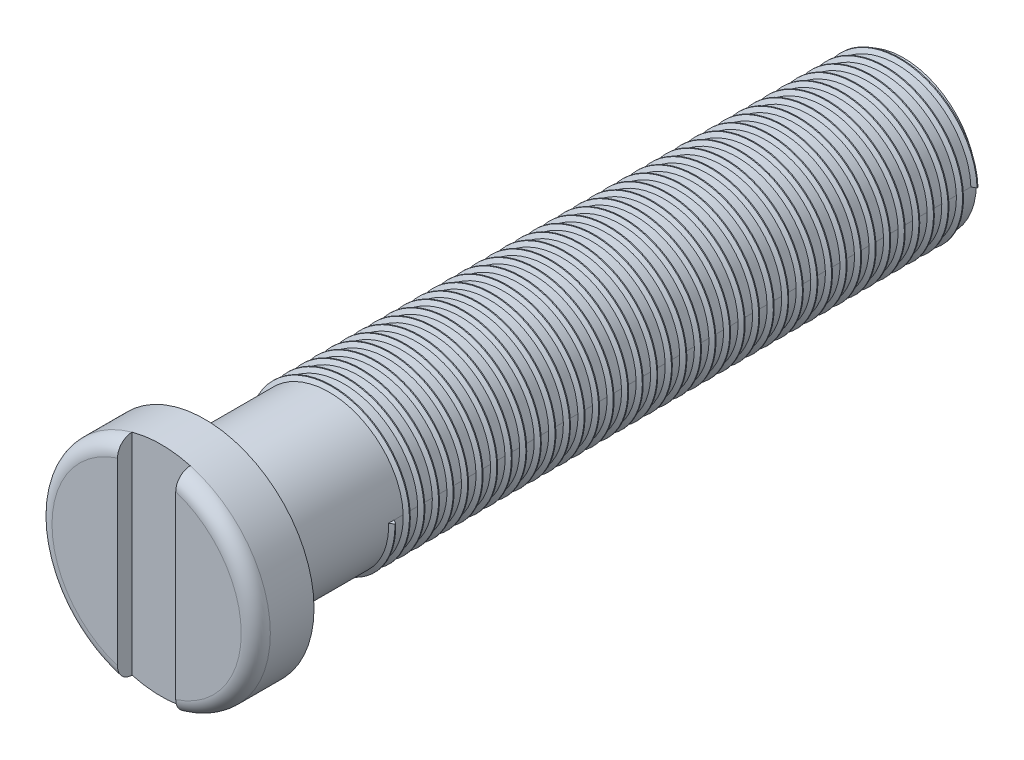
from build123d import *

# Parameters (mm, degrees)
SKETCH3_R           = 2.5
BOSS_EXTRUDE2_DEPTH = 24
SKETCH4_R           = 3.75
BOSS_EXTRUDE3_DEPTH = 2
FILLET2_R           = 0.5
SKETCH6_W           = 2
SKETCH6_H           = 7.5
CUT_EXTRUDE1_DEPTH  = 0.5
THREAD1_PITCH       = 0.5


with BuildPart() as part:
    # Sketch3 → Boss-Extrude2 (new body)
    with BuildSketch(Plane.XY):
        Circle(SKETCH3_R)
    extrude(amount=BOSS_EXTRUDE2_DEPTH)

    # Sketch4 → Boss-Extrude3 (add)
    with BuildSketch(Plane.XY.offset(24)):
        Circle(SKETCH4_R)
    extrude(amount=BOSS_EXTRUDE3_DEPTH)

    # Fillet2
    fillet2_edges = [part.edges().sort_by_distance(p)[0] for p in [
        (-3.75, 0, 26),
    ]]
    fillet(fillet2_edges, radius=FILLET2_R)

    # Sketch6 → Cut-Extrude1 (cut)
    with BuildSketch(Plane.XY.offset(26)):
        Rectangle(SKETCH6_W, SKETCH6_H)
    extrude(amount=-CUT_EXTRUDE1_DEPTH, mode=Mode.SUBTRACT)

    # Thread1: the profile of Thread Profile1 profile screwed along a right-hand helix of 40 turns, 6 arcs to a turn; built about Z, then put on its axis
    thread1_z = Axis((0, 0, 0), (0, 0, 1))
    thread1_corners = [(2.4997, 0, -0.000173205), (2.635316469, 0, 0.078125), (2.635316469, 0, 0.109375), (2.4997, 0, 0.187673204)]
    with BuildLine(mode=Mode.PRIVATE) as thread1_profile:
        Line(thread1_corners[0], thread1_corners[1])
        Line(thread1_corners[1], thread1_corners[2])
        Line(thread1_corners[2], thread1_corners[3])
        Line(thread1_corners[3], thread1_corners[0])
    thread1_cap = Face(thread1_profile.wire())
    thread1_turn_angles = [0, 30, 60, 90, 120, 150, 180, 210, 240, 270, 300, 330, 360, 390, 420, 450, 480, 510, 540, 570, 600, 630, 660, 690, 720]
    thread1_turn_weights = [1, 0.8660254037844387, 1, 0.8660254037844387, 1, 0.8660254037844387, 1, 0.8660254037844387, 1, 0.8660254037844387, 1, 0.8660254037844387, 1, 0.8660254037844387, 1, 0.8660254037844387, 1, 0.8660254037844387, 1, 0.8660254037844387, 1, 0.8660254037844387, 1, 0.8660254037844387, 1]
    thread1_turn_rails = [Edge.make_bspline([Vector(p[0], p[1], 0).rotate(thread1_z, thread1_turn_angles[k]) / thread1_turn_weights[k] + Vector(0, 0, p[2] + THREAD1_PITCH * thread1_turn_angles[k] / 360) for k in range(25)], [0, 0, 0, 1, 1, 2, 2, 3, 3, 4, 4, 5, 5, 6, 6, 7, 7, 8, 8, 9, 9, 10, 10, 11, 11, 12, 12, 12], 2, thread1_turn_weights) for p in thread1_corners]
    thread1_turn_sides = [Face.make_surface_from_curves(thread1_turn_rails[p[0]], thread1_turn_rails[p[1]]) for p in [(0, 1), (1, 2), (2, 3), (3, 0)]]
    thread1 = Plane(origin=(0, 0, 0), x_dir=(1, 0, 0), z_dir=(0, 0, 1)) * Solid(Shell([*[p.moved(Location((0, 0, 2 * THREAD1_PITCH * i))) for i in range(20) for p in thread1_turn_sides], thread1_cap, thread1_cap.rotate(thread1_z, 14400).moved(Location((0, 0, THREAD1_PITCH * 14400 / 360)))]))
    add(thread1)


solid = part.part
